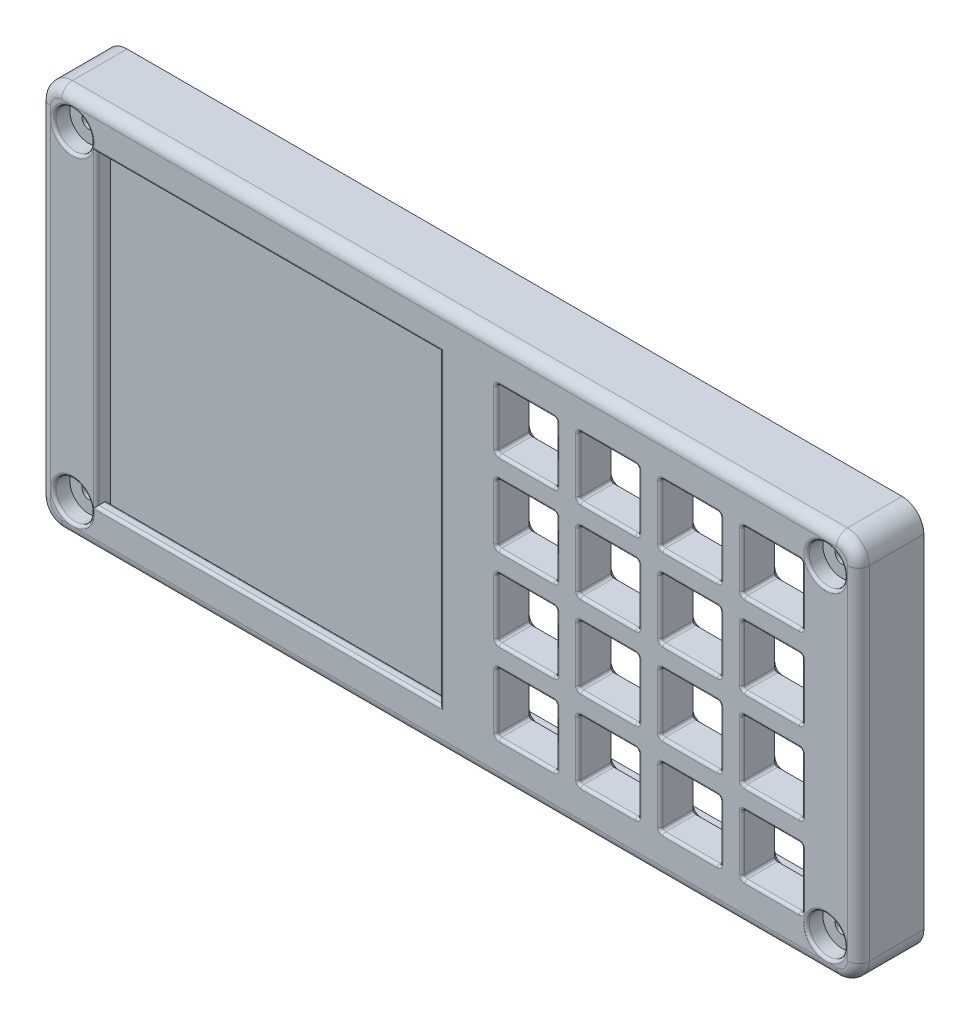
from build123d import *

# Parameters (mm, degrees)
SKETCH1_W                  = 150
SKETCH1_H                  = 70.75
BOSS_EXTRUDE1_DEPTH        = 7
SKETCH2_W                  = 11
SKETCH2_H                  = 11
CUT_EXTRUDE2_DEPTH         = 7
FILLET1_R                  = 0.5
CHAMFER1_SIZE              = 1
LPATTERN1_COUNT            = 4
LPATTERN1_PITCH            = 15
LPATTERN1_COUNT_DIR2       = 4
LPATTERN1_PITCH_DIR2       = 15
FILLET1_OF_LPATTERN1_R     = 0.5
CHAMFER1_OF_LPATTERN1_SIZE = 1
SKETCH3_W                  = 63.04
SKETCH3_H                  = 60.26
CUT_EXTRUDE3_DEPTH         = 2.65
SKETCH4_W                  = 63.04
SKETCH4_H                  = 2
BOSS_EXTRUDE2_DEPTH        = 2
SKETCH5_W                  = 63.04
SKETCH5_H                  = 2
BOSS_EXTRUDE4_DEPTH        = 2
FILLET3_R                  = 0.5
FILLET4_R                  = 0.5
FILLET5_R                  = 0.25
SKETCH6_W                  = 150
SKETCH6_H                  = 70.75
SKETCH6_W_2                = 145
SKETCH6_H_2                = 65.75
BOSS_EXTRUDE5_DEPTH        = 5
SKETCH7_W                  = 2.5
SKETCH7_H                  = 12
CUT_EXTRUDE5_DEPTH         = 5
FILLET6_R                  = 1
FILLET9_R                  = 4
FILLET10_R                 = 2
SKETCH8_W                  = 3.12
SKETCH8_H                  = 2.5
BOSS_EXTRUDE6_DEPTH        = 5
FILLET11_R                 = 1
FILLET12_R                 = 1
SKETCH9_R                  = 1.25
CUT_EXTRUDE6_DEPTH         = 15
SKETCH10_R                 = 3.5
CUT_EXTRUDE7_DEPTH         = 3
FILLET13_R                 = 1
SKETCH11_R                 = 2.25
SKETCH11_R_2               = 2
BOSS_EXTRUDE7_DEPTH        = 6.6
FILLET14_R                 = 0.4
SKETCH13_R                 = 3.25
BOSS_EXTRUDE8_DEPTH        = 4.8
FILLET15_R                 = 1
FILLET16_R                 = 0.5


# Some blends are built 0.0001 mm under size
with BuildPart() as part:
    # Sketch1 → Boss-Extrude1 (new body)
    with BuildSketch(Plane.XY):
        with Locations((75, 35.375)):
            Rectangle(SKETCH1_W, SKETCH1_H)
    extrude(amount=BOSS_EXTRUDE1_DEPTH)

    # Sketch2 → Cut-Extrude2 (cut)
    with BuildSketch(Plane.XY.offset(7)):
        with Locations((134.18, 57.875)):
            Rectangle(SKETCH2_W, SKETCH2_H)
    cut_extrude2 = extrude(amount=-CUT_EXTRUDE2_DEPTH, mode=Mode.SUBTRACT)

    # Fillet1
    fillet1_edges = [part.edges().sort_by_distance(p)[0] for p in [
        (139.68, 52.375, 3.5),
        (128.68, 52.375, 3.5),
        (134.18, 63.375, 7),
        (128.68, 63.375, 3.5),
        (139.68, 57.875, 7),
        (139.68, 63.375, 3.5),
        (134.18, 52.375, 7),
        (128.68, 57.875, 7),
    ]]
    fillet(fillet1_edges, radius=FILLET1_R)

    # Chamfer1
    chamfer1_edges = [part.edges().sort_by_distance(p)[0] for p in [
        (134.18, 63.375, 0),
        (139.68, 57.875, 0),
        (134.18, 52.375, 0),
        (128.68, 57.875, 0),
        (139.533553391, 63.228553391, 0),
        (139.533553391, 52.521446609, 0),
        (128.826446609, 52.521446609, 0),
        (128.826446609, 63.228553391, 0),
    ]]
    chamfer(chamfer1_edges, length=CHAMFER1_SIZE)

    # LPattern1: Cut-Extrude2 4 × 4
    with Locations(*[(-i * LPATTERN1_PITCH, -j * LPATTERN1_PITCH_DIR2, 0) for i in range(LPATTERN1_COUNT) for j in range(LPATTERN1_COUNT_DIR2) if (i, j) != (0, 0)]):
        add(cut_extrude2, mode=Mode.SUBTRACT)

    # Fillet1 of LPattern1
    fillet1_of_lpattern1_edges = [part.edges().sort_by_distance(p)[0] for p in [
        (139.68, 37.375, 3.5),
        (128.68, 37.375, 3.5),
        (134.18, 48.375, 7),
        (128.68, 48.375, 3.5),
        (139.68, 42.875, 7),
        (139.68, 48.375, 3.5),
        (134.18, 37.375, 7),
        (128.68, 42.875, 7),
        (139.68, 22.375, 3.5),
        (128.68, 22.375, 3.5),
        (134.18, 33.375, 7),
        (128.68, 33.375, 3.5),
        (139.68, 27.875, 7),
        (139.68, 33.375, 3.5),
        (134.18, 22.375, 7),
        (128.68, 27.875, 7),
        (139.68, 7.375, 3.5),
        (128.68, 7.375, 3.5),
        (134.18, 18.375, 7),
        (128.68, 18.375, 3.5),
        (139.68, 12.875, 7),
        (139.68, 18.375, 3.5),
        (134.18, 7.375, 7),
        (128.68, 12.875, 7),
        (124.68, 52.375, 3.5),
        (113.68, 52.375, 3.5),
        (119.18, 63.375, 7),
        (113.68, 63.375, 3.5),
        (124.68, 57.875, 7),
        (124.68, 63.375, 3.5),
        (119.18, 52.375, 7),
        (113.68, 57.875, 7),
        (124.68, 37.375, 3.5),
        (113.68, 37.375, 3.5),
        (119.18, 48.375, 7),
        (113.68, 48.375, 3.5),
        (124.68, 42.875, 7),
        (124.68, 48.375, 3.5),
        (119.18, 37.375, 7),
        (113.68, 42.875, 7),
        (124.68, 22.375, 3.5),
        (113.68, 22.375, 3.5),
        (119.18, 33.375, 7),
        (113.68, 33.375, 3.5),
        (124.68, 27.875, 7),
        (124.68, 33.375, 3.5),
        (119.18, 22.375, 7),
        (113.68, 27.875, 7),
        (124.68, 7.375, 3.5),
        (113.68, 7.375, 3.5),
        (119.18, 18.375, 7),
        (113.68, 18.375, 3.5),
        (124.68, 12.875, 7),
        (124.68, 18.375, 3.5),
        (119.18, 7.375, 7),
        (113.68, 12.875, 7),
        (109.68, 52.375, 3.5),
        (98.68, 52.375, 3.5),
        (104.18, 63.375, 7),
        (98.68, 63.375, 3.5),
        (109.68, 57.875, 7),
        (109.68, 63.375, 3.5),
        (104.18, 52.375, 7),
        (98.68, 57.875, 7),
        (109.68, 37.375, 3.5),
        (98.68, 37.375, 3.5),
        (104.18, 48.375, 7),
        (98.68, 48.375, 3.5),
        (109.68, 42.875, 7),
        (109.68, 48.375, 3.5),
        (104.18, 37.375, 7),
        (98.68, 42.875, 7),
        (109.68, 22.375, 3.5),
        (98.68, 22.375, 3.5),
        (104.18, 33.375, 7),
        (98.68, 33.375, 3.5),
        (109.68, 27.875, 7),
        (109.68, 33.375, 3.5),
        (104.18, 22.375, 7),
        (98.68, 27.875, 7),
        (109.68, 7.375, 3.5),
        (98.68, 7.375, 3.5),
        (104.18, 18.375, 7),
        (98.68, 18.375, 3.5),
        (109.68, 12.875, 7),
        (109.68, 18.375, 3.5),
        (104.18, 7.375, 7),
        (98.68, 12.875, 7),
        (94.68, 52.375, 3.5),
        (83.68, 52.375, 3.5),
        (89.18, 63.375, 7),
        (83.68, 63.375, 3.5),
        (94.68, 57.875, 7),
        (94.68, 63.375, 3.5),
        (89.18, 52.375, 7),
        (83.68, 57.875, 7),
        (94.68, 37.375, 3.5),
        (83.68, 37.375, 3.5),
        (89.18, 48.375, 7),
        (83.68, 48.375, 3.5),
        (94.68, 42.875, 7),
        (94.68, 48.375, 3.5),
        (89.18, 37.375, 7),
        (83.68, 42.875, 7),
        (94.68, 22.375, 3.5),
        (83.68, 22.375, 3.5),
        (89.18, 33.375, 7),
        (83.68, 33.375, 3.5),
        (94.68, 27.875, 7),
        (94.68, 33.375, 3.5),
        (89.18, 22.375, 7),
        (83.68, 27.875, 7),
        (94.68, 7.375, 3.5),
        (83.68, 7.375, 3.5),
        (89.18, 18.375, 7),
        (83.68, 18.375, 3.5),
        (94.68, 12.875, 7),
        (94.68, 18.375, 3.5),
        (89.18, 7.375, 7),
        (83.68, 12.875, 7),
    ]]
    fillet(fillet1_of_lpattern1_edges, radius=FILLET1_OF_LPATTERN1_R)

    # Chamfer1 of LPattern1
    chamfer1_of_lpattern1_edges = [part.edges().sort_by_distance(p)[0] for p in [
        (134.18, 48.375, 0),
        (139.68, 42.875, 0),
        (134.18, 37.375, 0),
        (128.68, 42.875, 0),
        (139.533553391, 48.228553391, 0),
        (139.533553391, 37.521446609, 0),
        (128.826446609, 37.521446609, 0),
        (128.826446609, 48.228553391, 0),
        (134.18, 33.375, 0),
        (139.68, 27.875, 0),
        (134.18, 22.375, 0),
        (128.68, 27.875, 0),
        (139.533553391, 33.228553391, 0),
        (139.533553391, 22.521446609, 0),
        (128.826446609, 22.521446609, 0),
        (128.826446609, 33.228553391, 0),
        (134.18, 18.375, 0),
        (139.68, 12.875, 0),
        (134.18, 7.375, 0),
        (128.68, 12.875, 0),
        (139.533553391, 18.228553391, 0),
        (139.533553391, 7.521446609, 0),
        (128.826446609, 7.521446609, 0),
        (128.826446609, 18.228553391, 0),
        (119.18, 63.375, 0),
        (124.68, 57.875, 0),
        (119.18, 52.375, 0),
        (113.68, 57.875, 0),
        (124.533553391, 63.228553391, 0),
        (124.533553391, 52.521446609, 0),
        (113.826446609, 52.521446609, 0),
        (113.826446609, 63.228553391, 0),
        (119.18, 48.375, 0),
        (124.68, 42.875, 0),
        (119.18, 37.375, 0),
        (113.68, 42.875, 0),
        (124.533553391, 48.228553391, 0),
        (124.533553391, 37.521446609, 0),
        (113.826446609, 37.521446609, 0),
        (113.826446609, 48.228553391, 0),
        (119.18, 33.375, 0),
        (124.68, 27.875, 0),
        (119.18, 22.375, 0),
        (113.68, 27.875, 0),
        (124.533553391, 33.228553391, 0),
        (124.533553391, 22.521446609, 0),
        (113.826446609, 22.521446609, 0),
        (113.826446609, 33.228553391, 0),
        (119.18, 18.375, 0),
        (124.68, 12.875, 0),
        (119.18, 7.375, 0),
        (113.68, 12.875, 0),
        (124.533553391, 18.228553391, 0),
        (124.533553391, 7.521446609, 0),
        (113.826446609, 7.521446609, 0),
        (113.826446609, 18.228553391, 0),
        (104.18, 63.375, 0),
        (109.68, 57.875, 0),
        (104.18, 52.375, 0),
        (98.68, 57.875, 0),
        (109.533553391, 63.228553391, 0),
        (109.533553391, 52.521446609, 0),
        (98.826446609, 52.521446609, 0),
        (98.826446609, 63.228553391, 0),
        (104.18, 48.375, 0),
        (109.68, 42.875, 0),
        (104.18, 37.375, 0),
        (98.68, 42.875, 0),
        (109.533553391, 48.228553391, 0),
        (109.533553391, 37.521446609, 0),
        (98.826446609, 37.521446609, 0),
        (98.826446609, 48.228553391, 0),
        (104.18, 33.375, 0),
        (109.68, 27.875, 0),
        (104.18, 22.375, 0),
        (98.68, 27.875, 0),
        (109.533553391, 33.228553391, 0),
        (109.533553391, 22.521446609, 0),
        (98.826446609, 22.521446609, 0),
        (98.826446609, 33.228553391, 0),
        (104.18, 18.375, 0),
        (109.68, 12.875, 0),
        (104.18, 7.375, 0),
        (98.68, 12.875, 0),
        (109.533553391, 18.228553391, 0),
        (109.533553391, 7.521446609, 0),
        (98.826446609, 7.521446609, 0),
        (98.826446609, 18.228553391, 0),
        (89.18, 63.375, 0),
        (94.68, 57.875, 0),
        (89.18, 52.375, 0),
        (83.68, 57.875, 0),
        (94.533553391, 63.228553391, 0),
        (94.533553391, 52.521446609, 0),
        (83.826446609, 52.521446609, 0),
        (83.826446609, 63.228553391, 0),
        (89.18, 48.375, 0),
        (94.68, 42.875, 0),
        (89.18, 37.375, 0),
        (83.68, 42.875, 0),
        (94.533553391, 48.228553391, 0),
        (94.533553391, 37.521446609, 0),
        (83.826446609, 37.521446609, 0),
        (83.826446609, 48.228553391, 0),
        (89.18, 33.375, 0),
        (94.68, 27.875, 0),
        (89.18, 22.375, 0),
        (83.68, 27.875, 0),
        (94.533553391, 33.228553391, 0),
        (94.533553391, 22.521446609, 0),
        (83.826446609, 22.521446609, 0),
        (83.826446609, 33.228553391, 0),
        (89.18, 18.375, 0),
        (94.68, 12.875, 0),
        (89.18, 7.375, 0),
        (83.68, 12.875, 0),
        (94.533553391, 18.228553391, 0),
        (94.533553391, 7.521446609, 0),
        (83.826446609, 7.521446609, 0),
        (83.826446609, 18.228553391, 0),
    ]]
    chamfer(chamfer1_of_lpattern1_edges, length=CHAMFER1_OF_LPATTERN1_SIZE)

    # Sketch3 → Cut-Extrude3 (cut)
    with BuildSketch(Plane.XY.offset(7)):
        with Locations((41.84, 35.375)):
            Rectangle(SKETCH3_W, SKETCH3_H)
    extrude(amount=-CUT_EXTRUDE3_DEPTH, mode=Mode.SUBTRACT)

    # Sketch4 → Boss-Extrude2 (add)
    with BuildSketch(Plane(origin=(0, 65.505, 0), x_dir=(-1, 0, 0), z_dir=(0, -1, 0))):
        with Locations((-41.84, -6)):
            Rectangle(SKETCH4_W, SKETCH4_H)
    extrude(amount=BOSS_EXTRUDE2_DEPTH)

    # Sketch5 → Boss-Extrude4 (add)
    with BuildSketch(Plane(origin=(0, 5.245, 0), x_dir=(1, 0, 0), z_dir=(0, 1, 0))):
        with Locations((41.84, -6)):
            Rectangle(SKETCH5_W, SKETCH5_H)
    extrude(amount=BOSS_EXTRUDE4_DEPTH)

    # Fillet3
    fillet3_edges = [part.edges().sort_by_distance(p)[0] for p in [
        (10.32, 35.375, 7),
        (41.84, 63.505, 7),
        (73.36, 35.375, 7),
        (41.84, 7.245, 7),
    ]]
    fillet(fillet3_edges, radius=FILLET3_R)

    # Fillet4
    fillet4_edges = [part.edges().sort_by_distance(p)[0] for p in [
        (41.84, 63.505, 5),
        (41.84, 7.245, 5),
    ]]
    fillet(fillet4_edges, radius=FILLET4_R)

    # Fillet5
    fillet5_edges = [part.edges().sort_by_distance(p)[0] for p in [
        (41.84, 65.505, 5),
        (41.84, 5.245, 5),
    ]]
    fillet(fillet5_edges, radius=FILLET5_R)

    # Sketch6 → Boss-Extrude5 (add)
    with BuildSketch(Plane(origin=(0, 0, 0), x_dir=(-1, 0, 0), z_dir=(0, 0, -1))):
        with Locations((-75, 35.375)):
            Rectangle(SKETCH6_W, SKETCH6_H)
        with Locations((-75, 35.375)):
            Rectangle(SKETCH6_W_2, SKETCH6_H_2, mode=Mode.SUBTRACT)
    extrude(amount=BOSS_EXTRUDE5_DEPTH)

    # Sketch7 → Cut-Extrude5 (cut)
    with BuildSketch(Plane(origin=(0, 0, -5), x_dir=(-1, 0, 0), z_dir=(0, 0, -1))):
        with Locations((-1.25, 46.62)):
            Rectangle(SKETCH7_W, SKETCH7_H)
    extrude(amount=-CUT_EXTRUDE5_DEPTH, mode=Mode.SUBTRACT)

    # Fillet6
    fillet6_edges = [part.edges().sort_by_distance(p)[0] for p in [
        (1.25, 52.62, 0),
        (0, 46.62, 0),
        (0, 52.62, -2.5),
        (1.25, 40.62, 0),
        (0, 40.62, -2.5),
    ]]
    fillet(fillet6_edges, radius=FILLET6_R)

    # Fillet9
    fillet9_edges = [part.edges().sort_by_distance(p)[0] for p in [
        (0, 70.75, 1),
        (150, 70.75, 1),
        (150, 0, 1),
        (0, 0, 1),
    ]]
    fillet(fillet9_edges, radius=FILLET9_R)

    # Fillet10
    fillet10_edges = [part.edges().sort_by_distance(p)[0] for p in [
        (0, 35.375, 7),
        (75, 0, 7),
        (1.171572875, 69.578427125, 7),
        (1.171572875, 1.171572875, 7),
        (148.828427125, 1.171572875, 7),
        (148.828427125, 69.578427125, 7),
        (75, 70.75, 7),
        (150, 35.375, 7),
    ]]
    fillet(fillet10_edges, radius=FILLET10_R)

    # Sketch8 → Boss-Extrude6 (add)
    with BuildSketch(Plane(origin=(0, 0, 0), x_dir=(-1, 0, 0), z_dir=(0, 0, -1))):
        with Locations((-4.06, 53.87)):
            Rectangle(SKETCH8_W, SKETCH8_H)
        with Locations((-4.06, 39.37)):
            Rectangle(SKETCH8_W, SKETCH8_H)
    extrude(amount=BOSS_EXTRUDE6_DEPTH)

    # Fillet11
    fillet11_edges = [part.edges().sort_by_distance(p)[0] for p in [
        (4.06, 52.62, 0),
        (4.06, 40.62, 0),
    ]]
    fillet(fillet11_edges, radius=FILLET11_R)

    # Fillet12
    fillet12_edges = [part.edges().sort_by_distance(p)[0] for p in [
        (4.06, 38.12, 0),
        (5.62, 38.12, -2.5),
        (5.62, 39.87, 0),
        (5.62, 55.12, -2.5),
        (5.62, 53.37, 0),
        (4.06, 55.12, 0),
    ]]
    fillet(fillet12_edges, radius=FILLET12_R)

    # Sketch9 → Cut-Extrude6 (cut)
    with BuildSketch(Plane.XY.offset(7)):
        with Locations((6, 64.75)):
            Circle(SKETCH9_R)
        with Locations((144, 64.75)):
            Circle(SKETCH9_R)
        with Locations((144, 6)):
            Circle(SKETCH9_R)
        with Locations((6, 6)):
            Circle(SKETCH9_R)
    extrude(amount=-CUT_EXTRUDE6_DEPTH, mode=Mode.SUBTRACT)

    # Sketch10 → Cut-Extrude7 (cut)
    with BuildSketch(Plane.XY.offset(7)):
        with Locations((6, 64.75)):
            Circle(SKETCH10_R)
        with Locations((144, 64.75)):
            Circle(SKETCH10_R)
        with Locations((144, 6)):
            Circle(SKETCH10_R)
        with Locations((6, 6)):
            Circle(SKETCH10_R)
    extrude(amount=-CUT_EXTRUDE7_DEPTH, mode=Mode.SUBTRACT)

    # Fillet13
    fillet13_edges = [part.edges().sort_by_distance(p)[0] for p in [
        (2.5, 55.12, -3),
        (2.5, 38.12, -3),
        (2.5, 37.827106781, -0.292893219),
        (2.5, 62.185, 0),
        (2.5, 55.412893219, -0.292893219),
        (2.5, 19.81, 0),
        (75, 68.25, 0),
        (147.5, 35.375, 0),
        (75, 2.5, 0),
        (2.5, 68.25, -2.5),
        (147.5, 68.25, -2.5),
        (147.5, 2.5, -2.5),
        (2.5, 2.5, -2.5),
    ]]
    fillet(fillet13_edges, radius=FILLET13_R)

    # Sketch11 → Boss-Extrude7 (add)
    with BuildSketch(Plane(origin=(0, 0, 0), x_dir=(-1, 0, 0), z_dir=(0, 0, -1))):
        with Locations((-23.56, 59.12)):
            Circle(SKETCH11_R)
        with Locations((-22.29, 10.86)):
            Circle(SKETCH11_R)
        with Locations((-71.36, 43.92)):
            Circle(SKETCH11_R_2)
        with Locations((-71.36, 15.94)):
            Circle(SKETCH11_R_2)
    extrude(amount=BOSS_EXTRUDE7_DEPTH)

    # Fillet14
    fillet14_edges = [part.edges().sort_by_distance(p)[0] for p in [
        (25.81, 59.12, -6.6),
        (24.54, 10.86, -6.6),
        (73.36, 43.92, -6.6),
        (73.36, 15.94, -6.6),
    ]]
    fillet(fillet14_edges, radius=FILLET14_R)

    # Sketch13 → Boss-Extrude8 (add)
    with BuildSketch(Plane(origin=(0, 0, 0), x_dir=(-1, 0, 0), z_dir=(0, 0, -1))):
        with Locations((-23.56, 59.12)):
            Circle(SKETCH13_R)
        with Locations((-22.29, 10.86)):
            Circle(SKETCH13_R)
        with Locations((-71.36, 15.94)):
            Circle(SKETCH13_R)
        with Locations((-71.36, 43.92)):
            Circle(SKETCH13_R)
    extrude(amount=BOSS_EXTRUDE8_DEPTH)

    # Fillet15
    fillet15_edges = [part.edges().sort_by_distance(p)[0] for p in [
        (74.61, 15.94, 0),
        (74.61, 15.94, -4.8),
        (26.81, 59.12, 0),
        (26.81, 59.12, -4.8),
        (25.54, 10.86, 0),
        (25.54, 10.86, -4.8),
        (74.61, 43.92, 0),
        (74.61, 43.92, -4.8),
    ]]
    fillet(fillet15_edges, radius=FILLET15_R - 0.0001)  # a hair under: the kernel refuses the full size

    # Fillet16
    # the kernel refuses this fillet: 0.5 mm, written as the material it takes off along each edge
    with BuildSketch(Plane(origin=(6, 6, 7), x_dir=(1, 0, 0), z_dir=(0, -1, 0))) as fillet16_piece_1:
        with BuildLine():
            CenterArc((3.5 + FILLET16_R, -FILLET16_R), FILLET16_R, 90, 90)
            Line((3.5 + FILLET16_R, 0), (3.5, 0))
            Line((3.5, 0), (3.5, -FILLET16_R))
        make_face()
    revolve(axis=Axis((6, 6, 7), (0, 0, 1)), mode=Mode.SUBTRACT)
    with BuildSketch(Plane(origin=(144, 6, 7), x_dir=(1, 0, 0), z_dir=(0, -1, 0))) as fillet16_piece_2:
        with BuildLine():
            CenterArc((3.5 + FILLET16_R, -FILLET16_R), FILLET16_R, 90, 90)
            Line((3.5 + FILLET16_R, 0), (3.5, 0))
            Line((3.5, 0), (3.5, -FILLET16_R))
        make_face()
    revolve(axis=Axis((144, 6, 7), (0, 0, 1)), mode=Mode.SUBTRACT)
    with BuildSketch(Plane(origin=(144, 64.75, 7), x_dir=(1, 0, 0), z_dir=(0, -1, 0))) as fillet16_piece_3:
        with BuildLine():
            CenterArc((3.5 + FILLET16_R, -FILLET16_R), FILLET16_R, 90, 90)
            Line((3.5 + FILLET16_R, 0), (3.5, 0))
            Line((3.5, 0), (3.5, -FILLET16_R))
        make_face()
    revolve(axis=Axis((144, 64.75, 7), (0, 0, 1)), mode=Mode.SUBTRACT)
    with BuildSketch(Plane(origin=(6, 64.75, 7), x_dir=(1, 0, 0), z_dir=(0, -1, 0))) as fillet16_piece_4:
        with BuildLine():
            CenterArc((3.5 + FILLET16_R, -FILLET16_R), FILLET16_R, 90, 90)
            Line((3.5 + FILLET16_R, 0), (3.5, 0))
            Line((3.5, 0), (3.5, -FILLET16_R))
        make_face()
    revolve(axis=Axis((6, 64.75, 7), (0, 0, 1)), mode=Mode.SUBTRACT)


solid = part.part
